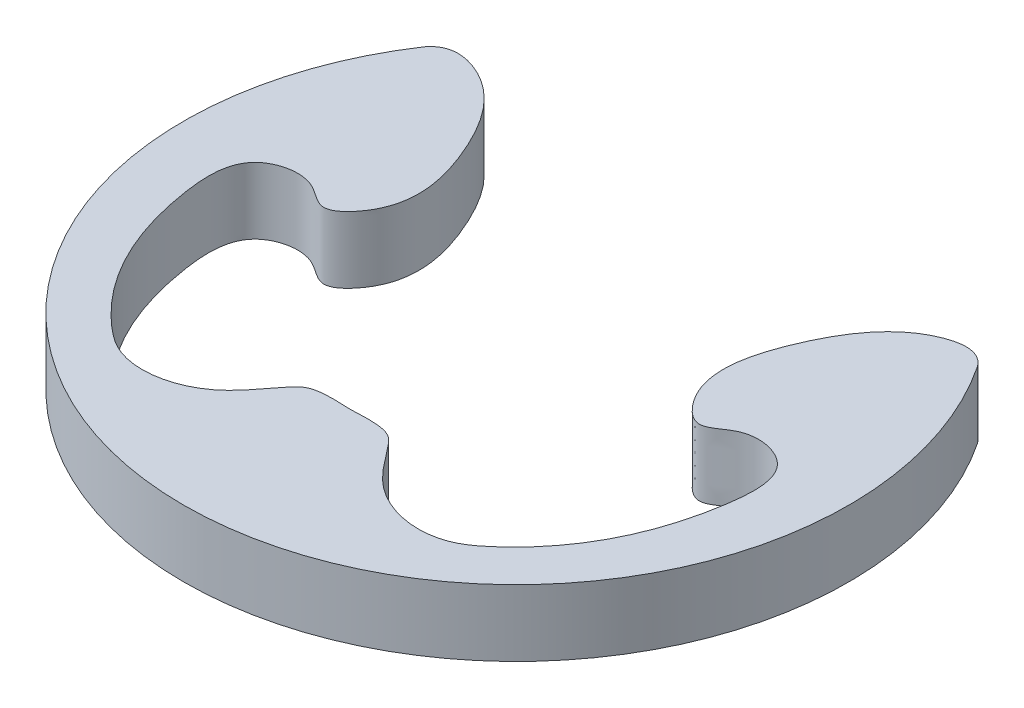
from build123d import *

# Parameters (mm, degrees)
SKETCH1_R           = 2
BOSS_EXTRUDE1_DEPTH = 0.4
CUT_EXTRUDE1_REACH  = 4.857


with BuildPart() as part:
    # Sketch1 → Boss-Extrude1 (new body)
    with BuildSketch(Plane(origin=(0, 0, 0), x_dir=(1, 0, 0), z_dir=(0, 1, 0))):
        Circle(SKETCH1_R)
    extrude(amount=BOSS_EXTRUDE1_DEPTH)

    # Sketch2 → Cut-Extrude1 (cut, up to next)
    with BuildSketch(Plane(origin=(0, 0.4, 0), x_dir=(1, 0, 0), z_dir=(0, 1, 0)), mode=Mode.PRIVATE) as cut_extrude1_sk1:
        with BuildLine():
            add(Edge.make_bspline(
                [(0, -1), (0.208250965, -0.98823624), (0.285688156, -1.025162743), (0.516134817, -1.395034291), (0.919266366, -1.467116927), (1.383294213, -1.105481229), (1.623532565, -0.635686702), (1.660887272, 0.031021168), (1.305653816, 0.110584823), (1.133558189, -0.076221339), (0.849044475, 0.192392761), (0.965822077, 0.703481395), (1.265336351, 1.154910658), (1.596101316, 1.200023422), (1.663870633, 1.109745249)],
                knots=[0, 0, 0, 0, 0.062885693, 0.124135561, 0.231355194, 0.267285206, 0.479704212, 0.555549734, 0.615510884, 0.651079781, 0.684138156, 0.810146857, 0.937553871, 0.995414322, 0.995414322, 0.995414322, 0.995414322], degree=3))
            ThreePointArc((1.663870633, 1.109745249), (0, 2), (-1.663870633, 1.109745249))
            add(Edge.make_bspline(
                [(-1.663870633, 1.109745249), (-1.596101316, 1.200023422), (-1.265336351, 1.154910658), (-0.965822077, 0.703481395), (-0.849044475, 0.192392761), (-1.133558189, -0.076221339), (-1.305653816, 0.110584823), (-1.660887272, 0.031021168), (-1.623532565, -0.635686702), (-1.383294213, -1.105481229), (-0.919266366, -1.467116927), (-0.516134817, -1.395034291), (-0.285688156, -1.025162743), (-0.208250965, -0.98823624), (0, -1)],
                knots=[0.753012483, 0.753012483, 0.753012483, 0.753012483, 0.810872934, 0.938279948, 1.06428865, 1.097347024, 1.132915921, 1.192877071, 1.268722593, 1.481141599, 1.517071611, 1.624291244, 1.685541113, 1.748426805, 1.748426805, 1.748426805, 1.748426805], degree=3))
        make_face()
    cut_extrude1_tool1 = extrude(cut_extrude1_sk1.sketch, amount=-CUT_EXTRUDE1_REACH, mode=Mode.PRIVATE) & part.part
    add(cut_extrude1_tool1.solids().sort_by_distance((0, 0.4, -0.253363))[0], mode=Mode.SUBTRACT)


solid = part.part
